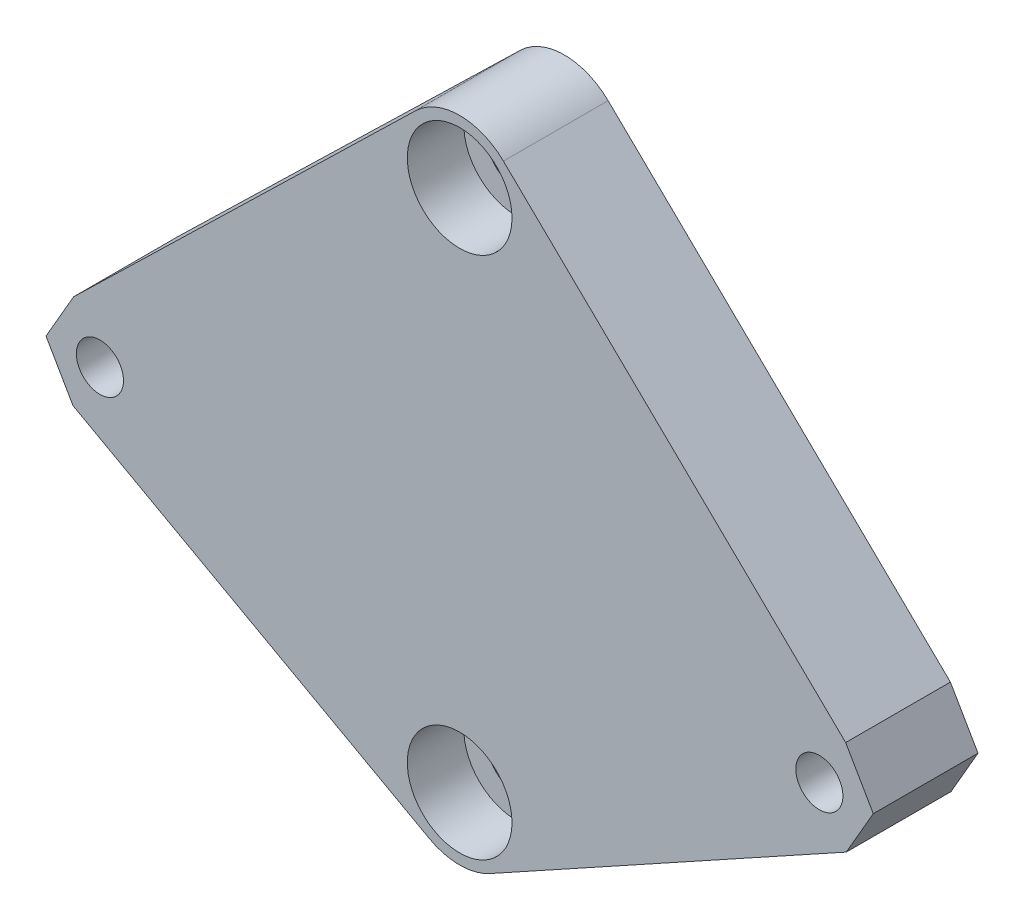
from build123d import *

# Parameters (mm, degrees)
SKETCH1_W                                       = 79
SKETCH1_H                                       = 70
BOSS_EXTRUDE1_DEPTH                             = 10
M4_CLEARANCE_HOLE1_D                            = 4.5
CUT_EXTRUDE3_DEPTH                              = 3.5
CBORE_FOR_M5_SOCKET_HEAD_CAP_SCREW1_D           = 5.5
CBORE_FOR_M5_SOCKET_HEAD_CAP_SCREW1_CBORE_D     = 10
CBORE_FOR_M5_SOCKET_HEAD_CAP_SCREW1_CBORE_DEPTH = 5.4
CUT_EXTRUDE4_DEPTH                              = 10


with BuildPart() as part:
    # Sketch1 → Boss-Extrude1 (new body)
    with BuildSketch(Plane.XY):
        with Locations((39.5, 35)):
            Rectangle(SKETCH1_W, SKETCH1_H)
    extrude(amount=BOSS_EXTRUDE1_DEPTH)

    # M4 Clearance Hole1 (through all)
    with Locations(Plane.XY.offset(10)):
        with Locations((5.15, 28), (73.85, 28)):
            Hole(M4_CLEARANCE_HOLE1_D / 2)

    # Sketch11 → Cut-Extrude3 (cut)
    with BuildSketch(Plane(origin=(0, 0, 0), x_dir=(-1, 0, 0), z_dir=(0, 0, -1))):
        Polygon((-69.635343035, 28), (-71.742671517, 31.65), (-75.957328483, 31.65), (-78.064656965, 28), (-75.957328483, 24.35), (-71.742671517, 24.35), align=None)
        Polygon((-9.364656965, 28), (-7.257328483, 24.35), (-3.042671517, 24.35), (-0.935343035, 28), (-3.042671517, 31.65), (-7.257328483, 31.65), align=None)
    extrude(amount=-CUT_EXTRUDE3_DEPTH, mode=Mode.SUBTRACT)

    # CBORE for M5 Socket Head Cap Screw1 (through all)
    with Locations(Plane.XY.offset(10)):
        with Locations((39.5, 60), (39.5, 10)):
            CounterBoreHole(CBORE_FOR_M5_SOCKET_HEAD_CAP_SCREW1_D / 2, CBORE_FOR_M5_SOCKET_HEAD_CAP_SCREW1_CBORE_D / 2, CBORE_FOR_M5_SOCKET_HEAD_CAP_SCREW1_CBORE_DEPTH)

    # Sketch17 → Cut-Extrude4 (cut)
    with BuildSketch(Plane(origin=(0, 0, 0), x_dir=(-1, 0, 0), z_dir=(0, 0, -1))):
        with BuildLine():
            Line((-125.188021535, 28), (-105.497086029, -6.105700744))
            Line((-105.497086029, -6.105700744), (-61.734857215, -30.269232978))
            ThreePointArc((-61.734857215, -30.269232978), (-39.5, -36), (-17.265142785, -30.269232978))
            Line((-17.265142785, -30.269232978), (26.497086029, -6.105700744))
            Line((26.497086029, -6.105700744), (46.188021535, 28))
            Line((46.188021535, 28), (29.223015539, 57.384252336))
            Line((29.223015539, 57.384252336), (-7.453662483, 93.00048866))
            ThreePointArc((-7.453662483, 93.00048866), (-39.5, 106), (-71.546337517, 93.00048866))
            Line((-71.546337517, 93.00048866), (-108.223015539, 57.384252336))
            Line((-108.223015539, 57.384252336), (-125.188021535, 28))
        make_face()
        with BuildLine():
            Line((-76.364414771, 32.564967524), (-43.679957067, 64.304411564))
            ThreePointArc((-43.679957067, 64.304411564), (-39.5, 66), (-35.320042933, 64.304411564))
            Line((-35.320042933, 64.304411564), (-2.635585229, 32.564967524))
            Line((-2.635585229, 32.564967524), (0, 28))
            Line((0, 28), (-2.579673838, 23.531873846))
            Line((-2.579673838, 23.531873846), (-36.599801233, 4.747491351))
            ThreePointArc((-36.599801233, 4.747491351), (-39.5, 4), (-42.400198767, 4.747491351))
            Line((-42.400198767, 4.747491351), (-76.420326162, 23.531873846))
            Line((-76.420326162, 23.531873846), (-79, 28))
            Line((-79, 28), (-76.364414771, 32.564967524))
        make_face(mode=Mode.SUBTRACT)
    extrude(amount=-CUT_EXTRUDE4_DEPTH, mode=Mode.SUBTRACT)


solid = part.part
